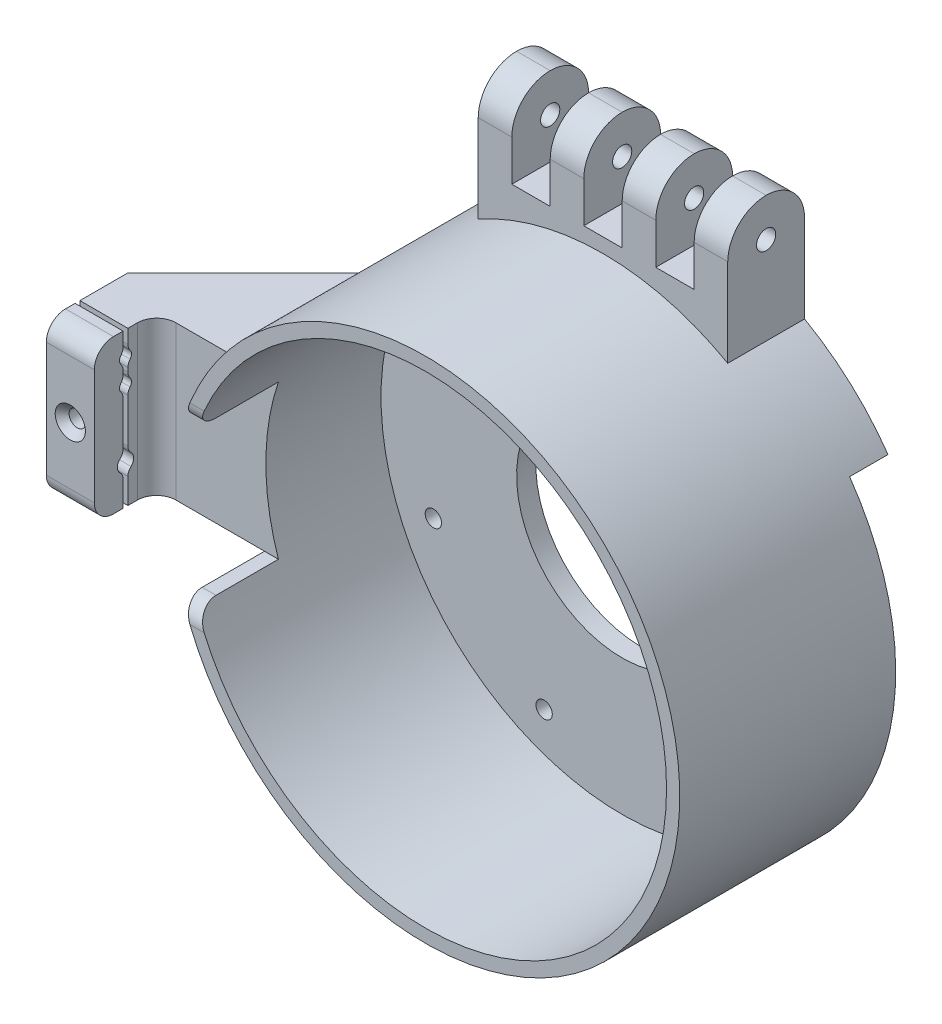
from build123d import *

# Parameters (mm, degrees)
SKETCH1_R               = 53
BOSS_EXTRUDE2_DEPTH     = 45
SKETCH2_R               = 50.25
CUT_EXTRUDE1_DEPTH      = 41
SKETCH4_R               = 22
CUT_EXTRUDE3_DEPTH      = 39
BOSS_EXTRUDE3_START     = 8
BOSS_EXTRUDE3_DEPTH     = 8
CUT_EXTRUDE5_DEPTH      = 10
CUT_EXTRUDE5_DEPTH_BACK = 10
SKETCH10_R              = 1.7
BOSS_EXTRUDE6_START     = -8
BOSS_EXTRUDE6_DEPTH     = 16
SKETCH13_W              = 7
SKETCH13_H              = 16
BOSS_EXTRUDE7_DEPTH     = 16.5
FILLET1_R               = 8
LPATTERN1_COUNT         = 4
LPATTERN1_PITCH         = 15
FILLET1_OF_LPATTERN1_R  = 8
CUT_EXTRUDE6_DEPTH      = 117.285209722
CUT_EXTRUDE6_DEPTH_BACK = 117.285209722
SKETCH14_R              = 2
CHAMFER1_SIZE           = 1.6
SKETCH15_W              = 27.561683899
SKETCH15_H              = 32
CUT_EXTRUDE7_DEPTH      = 10
BOSS_EXTRUDE8_START     = -2.47278
SKETCH17_W              = 28
SKETCH17_H              = 32
BOSS_EXTRUDE8_DEPTH     = 32.47278
CHAMFER2_SIZE           = 24
BOSS_EXTRUDE9_DEPTH     = 10
SKETCH25_R              = 1.4
CUT_EXTRUDE9_DEPTH      = 118.937483439
FILLET2_R               = 2
FILLET3_R               = 2
FILLET4_R               = 4
FILLET5_R               = 4
FILLET6_R               = 4


# Read off the part's stored shape, not the designer's step: Boss-Extrude6
with BuildPart() as part:
    # Sketch1 → Boss-Extrude2 (new body)
    with BuildSketch(Plane.XY):
        with Locations(Location((0, 0, 0), (0, 0, 180))):
            Circle(SKETCH1_R)
    extrude(amount=BOSS_EXTRUDE2_DEPTH)

    # Sketch2 → Cut-Extrude1 (cut)
    with BuildSketch(Plane.XY.offset(45)):
        Circle(SKETCH2_R)
    extrude(amount=-CUT_EXTRUDE1_DEPTH, mode=Mode.SUBTRACT)

    # Sketch4 → Cut-Extrude3 (cut)
    with BuildSketch(Plane(origin=(0, 0, 0), x_dir=(-1, 0, 0), z_dir=(0, 0, -1))):
        Circle(SKETCH4_R)
    extrude(amount=-CUT_EXTRUDE3_DEPTH, mode=Mode.SUBTRACT)

    # Sketch5 → Boss-Extrude3 (add)
    with BuildSketch(Plane(origin=(0, 0, 0), x_dir=(-1, 0, 0), z_dir=(0, 0, -1)).offset(BOSS_EXTRUDE3_START)):
        with BuildLine():
            Line((19.052558883, 11), (51.845925587, 11))
            ThreePointArc((51.845925587, 11), (10.588828865, 51.931461594), (-43.400241675, 30.42070056))
            Line((-43.400241675, 30.42070056), (-16.397830673, 14.666667965))
            ThreePointArc((-16.397830673, 14.666667965), (2.263406494, 21.883258236), (19.052558883, 11))
        make_face()
    extrude(amount=-BOSS_EXTRUDE3_DEPTH)

    # Sketch10 → Cut-Extrude5 (cut, two sides: drawn at the far end of the back side and taken through both)
    with BuildSketch(Plane(origin=(0, 0, 0), x_dir=(-1, 0, 0), z_dir=(0, 0, -1)).offset(-CUT_EXTRUDE5_DEPTH_BACK)):
        with Locations(Location((-39.264880132, -16.264045876, 0), (0, 0, 180))):
            Circle(SKETCH10_R)
        with Locations(Location((-39.17912216, 16.299303679, 0), (0, 0, 180))):
            Circle(SKETCH10_R)
        with Locations(Location((-16.092716827, 39.264428924, 0), (0, 0, 180))):
            Circle(SKETCH10_R)
        with Locations(Location((16.470632727, 39.178670952, 0), (0, 0, 180))):
            Circle(SKETCH10_R)
        with Locations(Location((39.435757972, 16.09226562, 0), (0, 0, 180))):
            Circle(SKETCH10_R)
        with Locations(Location((39.35, -16.471083935, 0), (0, 0, 180))):
            Circle(SKETCH10_R)
        with Locations(Location((16.263594668, -39.43620918, 0), (0, 0, 180))):
            Circle(SKETCH10_R)
        with Locations(Location((-16.299754887, -39.350451208, 0), (0, 0, 180))):
            Circle(SKETCH10_R)
    extrude(amount=CUT_EXTRUDE5_DEPTH + CUT_EXTRUDE5_DEPTH_BACK, mode=Mode.SUBTRACT)

    # Boss-Extrude6 outline → Boss-Extrude6 (add)
    with BuildSketch(Plane.XY.offset(BOSS_EXTRUDE6_START)):
        with BuildLine():
            Line((-26, 56), (-26, 46.184412955))
            ThreePointArc((-26, 46.184412955), (0, 53), (26, 46.184412955))
            Line((26, 46.184412955), (26, 56))
            Line((26, 56), (-26, 56))
        make_face()
    extrude(amount=BOSS_EXTRUDE6_DEPTH)

    # Sketch13 → Boss-Extrude7 (add)
    with BuildSketch(Plane(origin=(0, 56, 0), x_dir=(1, 0, 0), z_dir=(0, 1, 0))):
        with Locations((22.5, 0)):
            Rectangle(SKETCH13_W, SKETCH13_H)
    boss_extrude7 = extrude(amount=BOSS_EXTRUDE7_DEPTH)

    # Fillet1
    fillet1_edges = [part.edges().sort_by_distance(p)[0] for p in [
        (22.5, 72.5, 8),
        (22.5, 72.5, -8),
    ]]
    fillet(fillet1_edges, radius=FILLET1_R - 0.0001)  # a hair under: the kernel refuses the full size

    # LPattern1: Boss-Extrude7 ×4
    with Locations(*[(-i * LPATTERN1_PITCH, 0, 0) for i in range(1, LPATTERN1_COUNT)]):
        add(boss_extrude7)

    # Fillet1 of LPattern1
    fillet1_of_lpattern1_edges = [part.edges().sort_by_distance(p)[0] for p in [
        (7.5, 72.5, 8),
        (7.5, 72.5, -8),
        (-7.5, 72.5, 8),
        (-7.5, 72.5, -8),
        (-22.5, 72.5, 8),
        (-22.5, 72.5, -8),
    ]]
    fillet(fillet1_of_lpattern1_edges, radius=FILLET1_OF_LPATTERN1_R - 0.0001)  # a hair under: the kernel refuses the full size

    # Sketch14 → Cut-Extrude6 (cut, two sides: drawn at the far end of the back side and taken through both)
    with BuildSketch(Plane(origin=(26, 0, 0), x_dir=(0, 0, -1), z_dir=(1, 0, 0)).offset(-CUT_EXTRUDE6_DEPTH_BACK)):
        with Locations((0, 64.5)):
            Circle(SKETCH14_R)
    extrude(amount=CUT_EXTRUDE6_DEPTH + CUT_EXTRUDE6_DEPTH_BACK, mode=Mode.SUBTRACT)

    # Chamfer1
    chamfer1_edges = [part.edges().sort_by_distance(p)[0] for p in [
        (14.599754887, -39.350451208, 0),
        (-17.963594668, -39.43620918, 0),
        (-41.05, -16.471083935, 0),
        (-41.135757972, 16.09226562, -8),
        (-18.170632727, 39.178670952, -8),
        (14.392716827, 39.264428924, -8),
        (37.47912216, 16.299303679, 0),
        (37.564880132, -16.264045876, 0),
    ]]
    chamfer(chamfer1_edges, length=CHAMFER1_SIZE)

    # Sketch15 → Cut-Extrude7 (cut)
    with BuildSketch(Plane.ZY.offset(53)):
        with Locations((41.78084195, 0)):
            Rectangle(SKETCH15_W, SKETCH15_H)
    extrude(amount=-CUT_EXTRUDE7_DEPTH, mode=Mode.SUBTRACT)

    # Sketch17 → Boss-Extrude8 (add)
    with BuildSketch(Plane.ZY.offset(53).offset(BOSS_EXTRUDE8_START)):
        with Locations((14, 0)):
            Rectangle(SKETCH17_W, SKETCH17_H)
    extrude(amount=BOSS_EXTRUDE8_DEPTH)

    # Chamfer2
    chamfer2_edges = [part.edges().sort_by_distance(p)[0] for p in [
        (-83, 0, 0),
    ]]
    chamfer(chamfer2_edges, length=CHAMFER2_SIZE)

    # Sketch18 → Boss-Extrude9 (add)
    with BuildSketch(Plane.ZY.offset(83)):
        with BuildLine():
            Line((35, -16), (41, -16))
            Line((41, -16), (41, 16))
            Line((41, 16), (35, 16))
            Line((35, 16), (35, 12.145643924))
            ThreePointArc((35, 12.145643924), (35.75, 11), (35, 9.854356076))
            Line((35, 9.854356076), (35, 7.145643924))
            ThreePointArc((35, 7.145643924), (35.75, 6), (35, 4.854356076))
            Line((35, 4.854356076), (35, -6.375192319))
            ThreePointArc((35, -6.375192319), (36.2, -8), (35, -9.624807681))
            Line((35, -9.624807681), (35, -16))
        make_face()
        with BuildLine():
            Line((34, -16), (28, -16))
            Line((28, -16), (28, 16))
            Line((28, 16), (34, 16))
            Line((34, 16), (34, 12.145643924))
            ThreePointArc((34, 12.145643924), (33.25, 11), (34, 9.854356076))
            Line((34, 9.854356076), (34, 7.145643924))
            ThreePointArc((34, 7.145643924), (33.25, 6), (34, 4.854356076))
            Line((34, 4.854356076), (34, -6.375192319))
            ThreePointArc((34, -6.375192319), (32.8, -8), (34, -9.624807681))
            Line((34, -9.624807681), (34, -16))
        make_face()
    extrude(amount=-BOSS_EXTRUDE9_DEPTH)


with BuildPart() as boss_extrude9_piece_1:
    # of the separate pieces the step leaves, piece 1, a body of its own (boss_extrude9_pieces)
    add(part.part.solids().sort_by_distance((-59, 16, 0))[0])

    # Sketch25 → Cut-Extrude9 (cut, through all)
    with BuildSketch(Plane(origin=(0, 0, 34), x_dir=(-1, 0, 0), z_dir=(0, 0, -1))):
        with Locations((78, 0)):
            Circle(SKETCH25_R)
    extrude(amount=CUT_EXTRUDE9_DEPTH, mode=Mode.SUBTRACT)

    # Fillet3
    fillet3_edges = [boss_extrude9_piece_1.edges().sort_by_distance(p)[0] for p in [
        (-78, -9.624807681, 34),
        (-78, 12.145643924, 34),
        (-78, 9.854356076, 34),
        (-78, 7.145643924, 34),
        (-78, 4.854356076, 34),
        (-78, -6.375192319, 34),
    ]]
    fillet(fillet3_edges, radius=FILLET3_R)

    # Fillet4
    fillet4_edges = [boss_extrude9_piece_1.edges().sort_by_distance(p)[0] for p in [
        (-73, 0, 28),
    ]]
    fillet(fillet4_edges, radius=FILLET4_R)

    # Fillet5
    fillet5_edges = [boss_extrude9_piece_1.edges().sort_by_distance(p)[0] for p in [
        (-49.080948941, 16, 45),
        (-49.080948941, -16, 45),
    ]]
    fillet(fillet5_edges, radius=FILLET5_R)


with BuildPart() as boss_extrude9_piece_2:
    # of the separate pieces the step leaves, piece 2, a body of its own (boss_extrude9_pieces)
    add(part.part.solids().sort_by_distance((-83, -9.624807681, 35))[0])

    # Sketch22 → CSK for M3 Countersunk Flat Head Screw1 (revolve, cut)
    with BuildSketch(Plane(origin=(-78, 0, 41), x_dir=(0, -1, 0), z_dir=(1, 0, 0))):
        Polygon((0, 0), (0, 6), (1.7, 6), (1.7, 1.45), (3.15, 0), align=None)
    revolve(axis=Axis((-78, 0, 47.35), (0, 0, -1)), mode=Mode.SUBTRACT)

    # Fillet2
    fillet2_edges = [boss_extrude9_piece_2.edges().sort_by_distance(p)[0] for p in [
        (-78, -9.624807681, 35),
        (-78, -6.375192319, 35),
        (-78, 4.854356076, 35),
        (-78, 7.145643924, 35),
        (-78, 9.854356076, 35),
        (-78, 12.145643924, 35),
    ]]
    fillet(fillet2_edges, radius=FILLET2_R)

    # Fillet6
    fillet6_edges = [boss_extrude9_piece_2.edges().sort_by_distance(p)[0] for p in [
        (-78, 16, 41),
        (-78, -16, 41),
    ]]
    fillet(fillet6_edges, radius=FILLET6_R)


solid = Compound([boss_extrude9_piece_1.part, boss_extrude9_piece_2.part])
